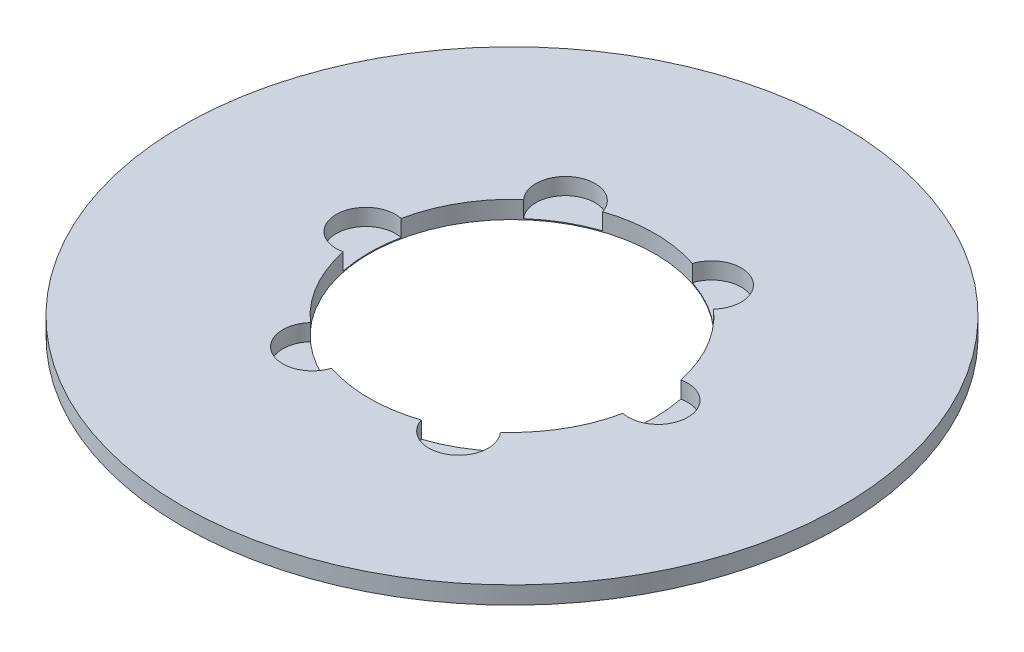
from build123d import *

# Parameters (mm, degrees)
SKETCH1_R           = 75
BOSS_EXTRUDE1_DEPTH = 4
SKETCH2_R           = 32.5
CUT_EXTRUDE1_DEPTH  = 107.141415103
SKETCH3_R           = 6.742825184
CUT_EXTRUDE2_DEPTH  = 3.784006922
CIRPATTERN1_COUNT   = 6


with BuildPart() as part:
    # Sketch1 → Boss-Extrude1 (new body)
    with BuildSketch(Plane(origin=(0, 0, 0), x_dir=(1, 0, 0), z_dir=(0, 1, 0))):
        Circle(SKETCH1_R)
    extrude(amount=BOSS_EXTRUDE1_DEPTH)

    # Sketch2 → Cut-Extrude1 (cut, through all)
    with BuildSketch(Plane(origin=(0, 0, 0), x_dir=(1, 0, 0), z_dir=(0, 1, 0))):
        Circle(SKETCH2_R)
    extrude(amount=CUT_EXTRUDE1_DEPTH, mode=Mode.SUBTRACT)

    # Sketch3 → Cut-Extrude2 (cut)
    with BuildSketch(Plane(origin=(0, 4, 0), x_dir=(1, 0, 0), z_dir=(0, 1, 0))):
        with Locations((-33.252237872, 0)):
            Circle(SKETCH3_R)
    cut_extrude2 = extrude(amount=-CUT_EXTRUDE2_DEPTH, mode=Mode.SUBTRACT)

    # CirPattern1: Cut-Extrude2 ×6 about axis
    cirpattern1_axis = Axis((0, 0, 0), (0, 1, 0))
    for i in range(1, CIRPATTERN1_COUNT):
        add(cut_extrude2.rotate(cirpattern1_axis, i * 360 / CIRPATTERN1_COUNT), mode=Mode.SUBTRACT)


solid = part.part
